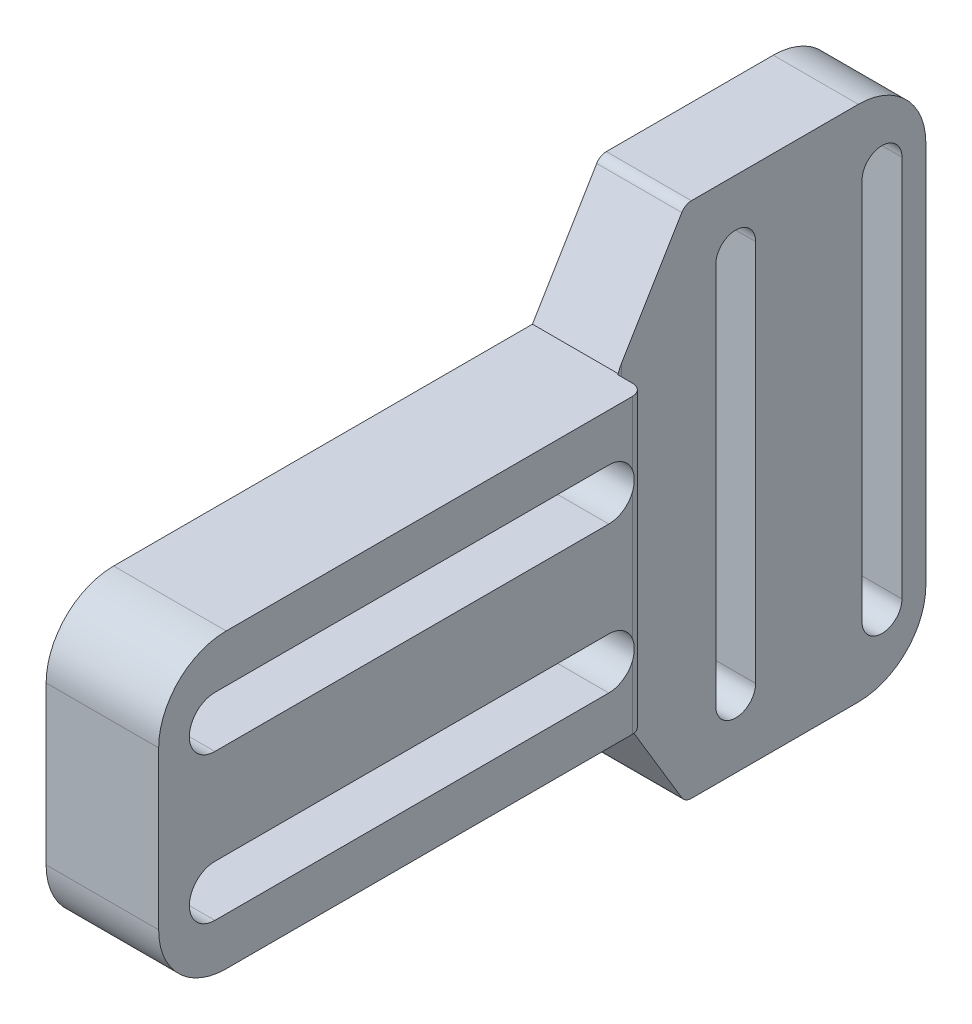
from build123d import *

# Parameters (mm, degrees)
SKETCH1_W           = 118.258395199
SKETCH1_H           = 33.02
BOSS_EXTRUDE1_DEPTH = 12.7
SKETCH2_W           = 3.1
SKETCH2_H           = 63.5
CUT_EXTRUDE1_DEPTH  = 96.476579779
CHAMFER1_SIZE       = 0.127
SKETCH5_W           = 63.373
SKETCH5_H           = 12.7
BOSS_EXTRUDE2_DEPTH = 9.6
CUT_EXTRUDE2_DEPTH  = 114.878760659
SKETCH4_W           = 10.16
SKETCH4_H           = 28.575
CUT_EXTRUDE3_DEPTH  = 107.95023743
CUT_EXTRUDE4_DEPTH  = 114.878760659
FILLET1_R           = 7.62
FILLET2_R           = 1.27


with BuildPart() as part:
    # Sketch1 → Boss-Extrude1 (new body)
    with BuildSketch(Plane(origin=(21.512469627, 0, 0), x_dir=(0, 0, -1), z_dir=(1, 0, 0))):
        with Locations((-23.66551122, 48.386703028)):
            Rectangle(SKETCH1_W, SKETCH1_H)
        with BuildLine():
            Line((-76.444708819, 59.526711228), (-31.994708819, 59.526711228))
            ThreePointArc((-31.994708819, 59.526711228), (-29.109700619, 56.641703028), (-31.994708819, 53.756694828))
            Line((-31.994708819, 53.756694828), (-76.444708819, 53.756694828))
            ThreePointArc((-76.444708819, 53.756694828), (-79.329717019, 56.641703028), (-76.444708819, 59.526711228))
        make_face(mode=Mode.SUBTRACT)
        with BuildLine():
            Line((-76.444708819, 37.246694828), (-31.994708819, 37.246694828))
            ThreePointArc((-31.994708819, 37.246694828), (-29.109700619, 40.131703028), (-31.994708819, 43.016711228))
            Line((-31.994708819, 43.016711228), (-76.444708819, 43.016711228))
            ThreePointArc((-76.444708819, 43.016711228), (-79.329717019, 40.131703028), (-76.444708819, 37.246694828))
        make_face(mode=Mode.SUBTRACT)
    extrude(amount=BOSS_EXTRUDE1_DEPTH)

    # Sketch2 → Cut-Extrude1 (cut, through all)
    with BuildSketch(Plane(origin=(0, 64.896703028, 0), x_dir=(1, 0, 0), z_dir=(0, 1, 0))):
        with Locations((32.662469627, 3.71368638)):
            Rectangle(SKETCH2_W, SKETCH2_H)
    extrude(amount=-CUT_EXTRUDE1_DEPTH, mode=Mode.SUBTRACT)

    # Chamfer1
    chamfer1_edges = [part.edges().sort_by_distance(p)[0] for p in [
        (31.112469627, 48.386703028, 28.03631362),
    ]]
    chamfer(chamfer1_edges, length=CHAMFER1_SIZE)

    # Sketch5 → Boss-Extrude2 (add)
    with BuildSketch(Plane(origin=(31.112469627, 0, 0), x_dir=(0, 0, -1), z_dir=(1, 0, 0))):
        with Locations((3.77718638, 25.526703028)):
            Rectangle(SKETCH5_W, SKETCH5_H)
        with Locations((3.77718638, 71.246703028)):
            Rectangle(SKETCH5_W, SKETCH5_H)
    extrude(amount=-BOSS_EXTRUDE2_DEPTH)

    # Sketch3 → Cut-Extrude2 (cut, through all)
    with BuildSketch(Plane(origin=(31.112469627, 0, 0), x_dir=(0, 0, -1), z_dir=(1, 0, 0))):
        with BuildLine():
            Line((4.18568638, 69.976703028), (4.18568638, 26.796703028))
            ThreePointArc((4.18568638, 26.796703028), (1.93568638, 24.546703028), (-0.31431362, 26.796703028))
            Line((-0.31431362, 26.796703028), (-0.31431362, 69.976703028))
            ThreePointArc((-0.31431362, 69.976703028), (1.93568638, 72.226703028), (4.18568638, 69.976703028))
        make_face()
        with BuildLine():
            Line((-16.82431362, 69.976703028), (-16.82431362, 26.796703028))
            ThreePointArc((-16.82431362, 26.796703028), (-14.57431362, 24.546703028), (-12.32431362, 26.796703028))
            Line((-12.32431362, 26.796703028), (-12.32431362, 69.976703028))
            ThreePointArc((-12.32431362, 69.976703028), (-14.57431362, 72.226703028), (-16.82431362, 69.976703028))
        make_face()
    extrude(amount=-CUT_EXTRUDE2_DEPTH, mode=Mode.SUBTRACT)

    # Sketch4 → Cut-Extrude3 (cut, through all)
    with BuildSketch(Plane(origin=(0, 77.596703028, 0), x_dir=(1, 0, 0), z_dir=(0, 1, 0))):
        with Locations((26.592469627, 21.17618638)):
            Rectangle(SKETCH4_W, SKETCH4_H)
    extrude(amount=-CUT_EXTRUDE3_DEPTH, mode=Mode.SUBTRACT)

    # Sketch6 → Cut-Extrude4 (cut, through all)
    with BuildSketch(Plane(origin=(31.112469627, 0, 0), x_dir=(0, 0, -1), z_dir=(1, 0, 0))):
        Polygon((-27.90931362, 64.896703028), (-20.28931362, 77.596703028), (-27.90931362, 77.596703028), align=None)
        Polygon((-20.28931362, 19.176703028), (-27.90931362, 19.176703028), (-27.90931362, 31.876703028), align=None)
    extrude(amount=-CUT_EXTRUDE4_DEPTH, mode=Mode.SUBTRACT)

    # Fillet1
    fillet1_edges = [part.edges().sort_by_distance(p)[0] for p in [
        (26.312469627, 77.596703028, -6.88868638),
        (26.312469627, 19.176703028, -6.88868638),
        (27.862469627, 64.896703028, 82.794708819),
        (27.862469627, 31.876703028, 82.794708819),
    ]]
    fillet(fillet1_edges, radius=FILLET1_R)

    # Fillet2
    # the kernel refuses this fillet: 1.27 mm, written as the material it adds along each edge
    with BuildSketch(Plane(origin=(31.112469627, 65.963153443, 27.90931362), x_dir=(0.7071067811865475, 0, 0.7071067811865475), z_dir=(0, -1, 0))) as fillet2_piece_1_section:
        with BuildLine():
            CenterArc((0.596387884, -1.19966334), FILLET2_R, 109.158067237, 25.841932763)
            Line((-0.301637728, -0.301637728), (0, 0))
            Line((0, 0), (0.179605122, 0))
        make_face()
    fillet2_piece_1 = extrude(amount=35.152900829, mode=Mode.PRIVATE)
    fillet2_piece_1 = split(fillet2_piece_1, bisect_by=Plane(origin=(31.112469627, 65.680857745, 27.43882079), z_dir=(0, -0.5144957554275265, -0.8574929257125442)), keep=Keep.TOP, mode=Mode.PRIVATE)
    fillet2_piece_1 = split(fillet2_piece_1, bisect_by=Plane(origin=(31.112469627, 56.940269509, 42.947453509), z_dir=(0, 0.5144957554275265, -0.8574929257125442)), keep=Keep.TOP, mode=Mode.PRIVATE)
    add(fillet2_piece_1)
    with BuildSketch(Plane(origin=(31.112469627, 64.896703028, 27.90931362), x_dir=(0.7071067811865475, 0, 0.7071067811865475), z_dir=(0, -1, 0))) as fillet2_piece_2:
        with BuildLine():
            CenterArc((0.596387884, -1.19966334), FILLET2_R, 109.158067237, 25.841932763)
            Line((-0.301637728, -0.301637728), (0, 0))
            Line((0, 0), (0.179605122, 0))
        make_face()
    extrude(amount=33.02)
    # the kernel refuses this fillet: 1.27 mm, written as the material it takes off along each edge
    with BuildSketch(Plane(origin=(34.212469627, 68.071703028, 28.03631362), x_dir=(-1, 0, 0), z_dir=(0, -1, 0))) as fillet2_2_piece_1:
        with BuildLine():
            CenterArc((FILLET2_R, -FILLET2_R), FILLET2_R, 90, 90)
            Line((0, -FILLET2_R), (0, 0))
            Line((0, 0), (FILLET2_R, 0))
        make_face()
    extrude(amount=39.37, mode=Mode.SUBTRACT)
    with BuildSketch(Plane(origin=(32.91012408, 77.596703028, 20.28931362), x_dir=(0, 0, -1), z_dir=(-1, 0, 0)), Plane(origin=(32.91012408, 19.176703028, 20.28931362), x_dir=(0, 0.8574929257125441, 0.5144957554275265), z_dir=(-1, 0, 0))) as fillet2_2_piece_2:
        with BuildLine():
            CenterArc((FILLET2_R * 0.566190378969, FILLET2_R), FILLET2_R, 210.963756532, 59.036243468)
            Line((-FILLET2_R * 0.291302546743, FILLET2_R * 0.485504244572), (0, 0))
            Line((0, 0), (FILLET2_R * 0.566190378969, 0))
        make_face()
    extrude(amount=13.195308906, mode=Mode.SUBTRACT)


solid = part.part
